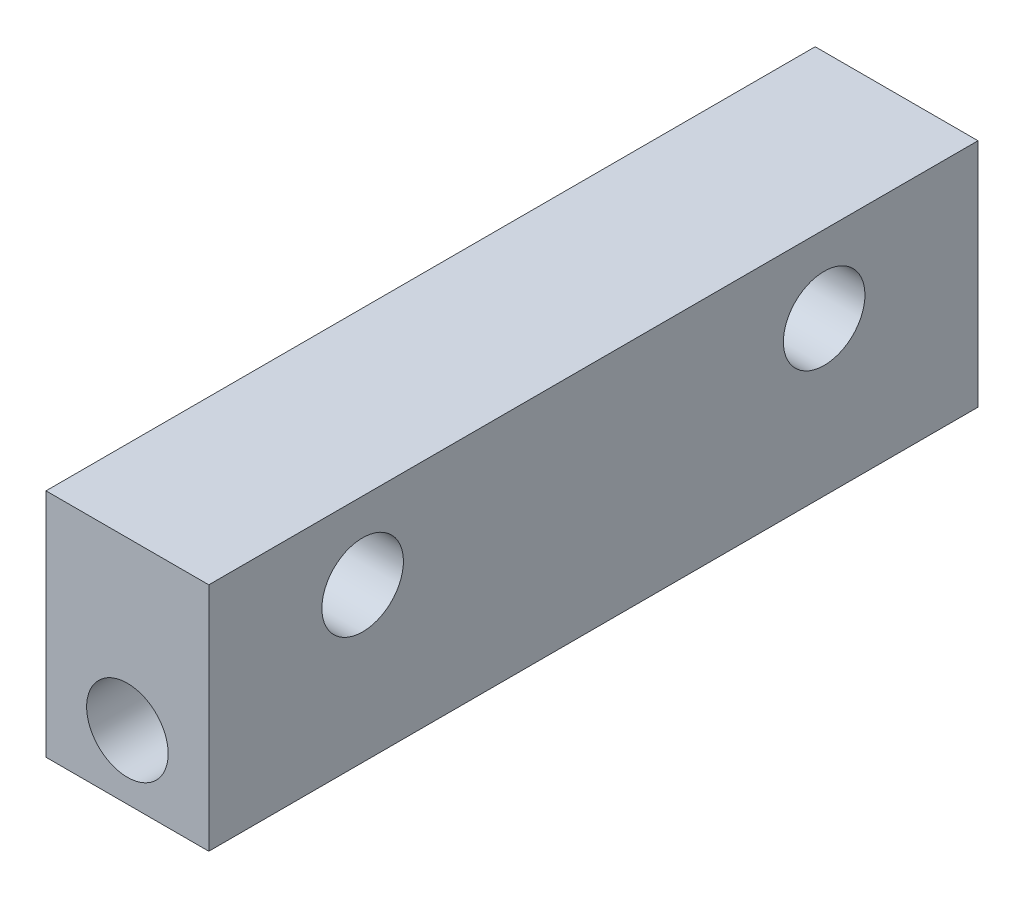
from build123d import *

# Parameters (mm, degrees)
SKETCH1_W           = 6.35
SKETCH1_H           = 9
SKETCH1_R           = 1.59
BOSS_EXTRUDE1_DEPTH = 30
SKETCH2_R           = 1.59
CUT_EXTRUDE1_DEPTH  = 30


with BuildPart() as part:
    # Sketch1 → Boss-Extrude1 (new body)
    with BuildSketch(Plane.XY):
        with Locations((3.175, -4.5)):
            Rectangle(SKETCH1_W, SKETCH1_H)
        with Locations((3.175, -6.5)):
            Circle(SKETCH1_R, mode=Mode.SUBTRACT)
    extrude(amount=BOSS_EXTRUDE1_DEPTH)

    # Sketch2 → Cut-Extrude1 (cut)
    with BuildSketch(Plane(origin=(0, 0, 0), x_dir=(0, 0, -1), z_dir=(1, 0, 0))):
        with Locations((-24, -3)):
            Circle(SKETCH2_R)
        with Locations((-6, -3)):
            Circle(SKETCH2_R)
    extrude(amount=CUT_EXTRUDE1_DEPTH, mode=Mode.SUBTRACT)


solid = part.part
